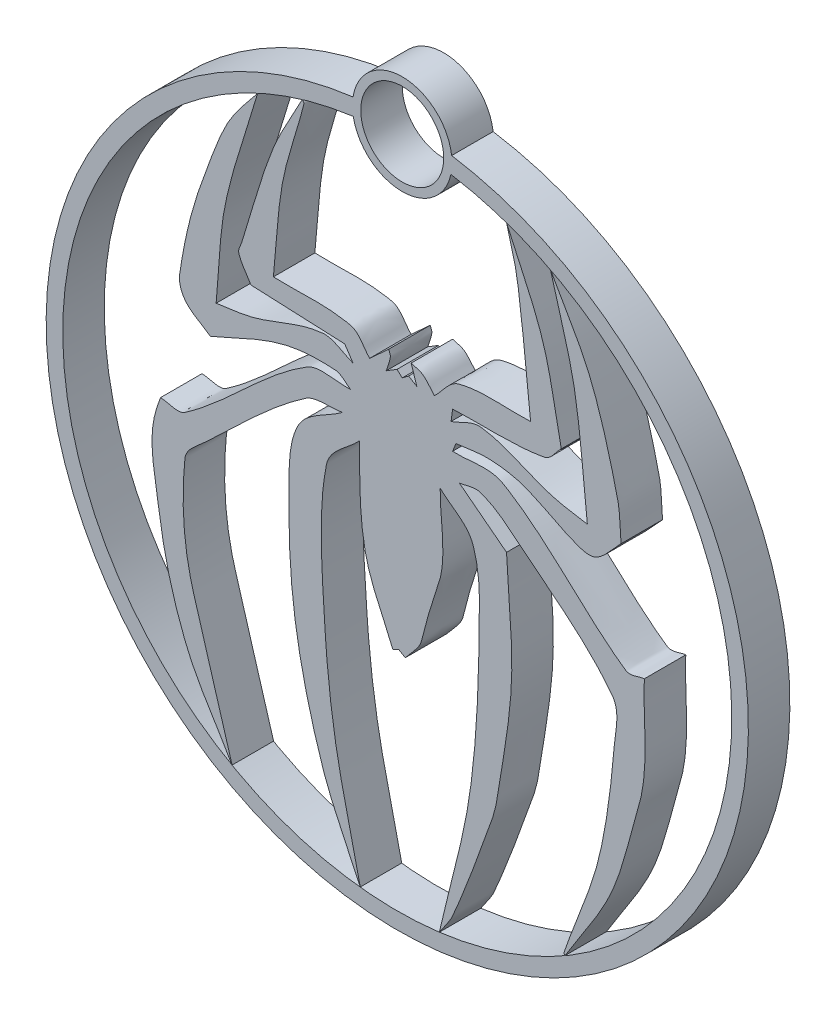
from build123d import *

# Parameters (mm, degrees)
BOSS_EXTRUDE1_DEPTH = 50
SKETCH1_4_R         = 50
BOSS_EXTRUDE2_DEPTH = 50


with BuildPart() as part:
    # Sketch1 → Boss-Extrude1 (new body)
    with BuildSketch(Plane.XY):
        with BuildLine():
            Line((853, 918), (830, 897))
            add(Edge.make_bspline(
                [(714, 924), (745, 922.666666667), (776.779172775, 927.034158061), (807, 920), (817.560023831, 917.542063419), (822.333333333, 904.666666667), (830, 897)],
                knots=[0, 0, 0, 0, 1, 1, 1, 2, 2, 2, 2], degree=3))
            add(Edge.make_bspline(
                [(748.807903572, 1126.549902984), (749.499965997, 1125.457958941), (751.187832385, 1124.53066676), (750.884090847, 1123.274070854), (743.160818122, 1091.32245522), (730.996535349, 1060.435291137), (725.013838745, 1028.112512411), (718.662403289, 993.797544357), (717.671279582, 958.704170804), (714, 924)],
                knots=[0, 0, 0, 0, 1, 1, 1, 2, 2, 2, 3, 3, 3, 3], degree=3))
            add(Edge.make_bspline(
                [(687, 902), (682.132270872, 910.611900498), (675.158519698, 918.3366178), (672.396812615, 927.835701495), (671.167351835, 932.064517402), (674.452537828, 936.407602746), (675.775289638, 940.608172402), (687.851726885, 978.958462653), (697.890697373, 1018.049572234), (712.589625278, 1055.47318266), (722.310799686, 1080.223385281), (736.735144141, 1102.857662876), (748.807903572, 1126.549902984)],
                knots=[0, 0, 0, 0, 1, 1, 1, 2, 2, 2, 3, 3, 3, 4, 4, 4, 4], degree=3))
            Line((687, 902), (800, 897))
            Line((800, 897), (810, 882))
            add(Edge.make_bspline(
                [(645, 862), (659.333333333, 864.333333333), (673.937806149, 865.374590648), (688, 869), (716.691021266, 876.39690392), (743.537603082, 891.860564263), (773, 895), (785.998858399, 896.385124256), (797.666666667, 886.333333333), (810, 882)],
                knots=[0, 0, 0, 0, 1, 1, 1, 2, 2, 2, 3, 3, 3, 3], degree=3))
            add(Edge.make_bspline(
                [(695, 1106), (682, 1061), (665.402999701, 1016.886638541), (656, 971), (648.669161244, 935.22550687), (648.666666667, 898.333333333), (645, 862)],
                knots=[0, 0, 0, 0, 1, 1, 1, 2, 2, 2, 2], degree=3))
            add(Edge.make_bspline(
                [(638, 824), (628, 831.333333333), (615.772256472, 836.337194656), (608, 846), (602.777011293, 852.493445419), (599.812741137, 861.751675271), (601, 870), (606.275492274, 906.650788428), (614.515152584, 943.139711761), (627, 978), (657.408327541, 1062.906369108), (658.716781846, 1061.179554045), (695, 1106)],
                knots=[0, 0, 0, 0, 1, 1, 1, 2, 2, 2, 3, 3, 3, 4, 4, 4, 4], degree=3))
            add(Edge.make_bspline(
                [(807, 853), (801, 856.666666667), (796.013373278, 863.493009161), (789, 864), (767.32588298, 865.56680364), (745.00614433, 864.564541544), (724, 859), (694.082127801, 851.074735841), (666.666666667, 835.666666667), (638, 824)],
                knots=[0, 0, 0, 0, 1, 1, 1, 2, 2, 2, 3, 3, 3, 3], degree=3))
            add(Edge.make_bspline(
                [(578, 730), (587.666666667, 729.666666667), (599.008388664, 723.551174089), (607, 729), (659.436333139, 764.752045322), (700.061116149, 816.557892012), (754, 850), (769.038982167, 859.324168944), (789.333333333, 852), (807, 853)],
                knots=[0, 0, 0, 0, 1, 1, 1, 2, 2, 2, 3, 3, 3, 3], degree=3))
            add(Edge.make_bspline(
                [(664.295395655, 389.339676843), (645.92602994, 421.882933624), (623.416536006, 452.414766476), (609.187298512, 486.969447186), (594.510435756, 522.611153675), (584.13086398, 560.291692971), (578.214769352, 598.380291871), (567.753529298, 665.731137564), (560.969349446, 686.564113594), (578, 730)],
                knots=[0, 0, 0, 0, 1, 1, 1, 2, 2, 2, 3, 3, 3, 3], degree=3))
            add(Edge.make_bspline(
                [(797, 824), (782.186255781, 821.509084593), (764.93630489, 825.038907063), (752.558767342, 816.52725378), (708.444039653, 786.190907371), (670.969694886, 747.116340911), (631.925686129, 710.48345278), (622.403465214, 701.549266342), (608.400074174, 693.12130585), (607.175121958, 680.121618526), (602.950264034, 635.285721002), (605.161082018, 588.631255238), (617.939003511, 545.447556305), (633.340704553, 493.396647926), (648.724230286, 441.340140948), (664.295395655, 389.339676843)],
                knots=[0, 0, 0, 0, 1, 1, 1, 2, 2, 2, 3, 3, 3, 4, 4, 4, 5, 5, 5, 5], degree=3))
            add(Edge.make_bspline(
                [(818.747711161, 339.269839649), (803.617628269, 373.444822067), (785.13080843, 406.323148135), (773.357462485, 441.794786902), (759.1165288, 484.700963085), (747.9358369, 528.82940624), (741.003827866, 573.50256818), (734.35988778, 616.319276852), (732.224304235, 659.904731985), (732.790100312, 703.230155886), (733.143603872, 730.299434411), (731.040234071, 759.798987998), (743.748869708, 783.702154835), (754.198763531, 803.356944114), (779.249623236, 810.567384945), (797, 824)],
                knots=[0, 0, 0, 0, 1, 1, 1, 2, 2, 2, 3, 3, 3, 4, 4, 4, 5, 5, 5, 5], degree=3))
            add(Edge.make_bspline(
                [(818, 805), (804.612268242, 789.890017522), (781.692895636, 779.486043457), (777.836804726, 759.670052565), (767.012241716, 704.043915357), (772.709880371, 646.238468315), (776.097934025, 589.6702847), (779.355372721, 535.28289624), (786.277501979, 480.855515055), (798.4876641, 427.756448478), (805.268718476, 398.267269365), (811.994362141, 368.765375926), (818.747711161, 339.269839649)],
                knots=[0, 0, 0, 0, 1, 1, 1, 2, 2, 2, 3, 3, 3, 4, 4, 4, 4], degree=3))
            add(Edge.make_bspline(
                [(858, 607), (847.333333333, 633.666666667), (832.615076179, 659.051303143), (826, 687), (816.91983626, 725.363691802), (818, 765.576374821), (818, 805)],
                knots=[0, 0, 0, 0, 1, 1, 1, 2, 2, 2, 2], degree=3))
            Line((858, 607), (864.822790605, 610.672691083))
            Line((864.822790605, 610.672691083), (873, 606))
            add(Edge.make_bspline(
                [(915, 804), (914.652871367, 770.328522596), (923.865485221, 734.872089982), (913, 703), (882.795455375, 614.400002434), (903.009742143, 641.466058896), (873, 606)],
                knots=[0, 0, 0, 0, 1, 1, 1, 2, 2, 2, 2], degree=3))
            add(Edge.make_bspline(
                [(914, 340), (926.333333333, 395), (943.074894972, 449.194052096), (951, 505), (959.124372139, 562.209120481), (961.335870084, 620.220697301), (962, 678), (962.338532765, 707.452350519), (964.294073125, 738.403123111), (954, 766), (947.656489026, 783.006008143), (928, 791.333333333), (915, 804)],
                knots=[0, 0, 0, 0, 1, 1, 1, 2, 2, 2, 3, 3, 3, 4, 4, 4, 4], degree=3))
            add(Edge.make_bspline(
                [(995, 777), (997, 733), (1002.854674398, 689.006365254), (1001, 645), (999.173691938, 601.666690526), (990.553946299, 558.87373204), (984, 516), (982.546225991, 506.489895022), (980.22418735, 497.064224814), (977, 488), (962.539080656, 447.345717315), (947.900285267, 406.702257452), (931, 367), (926.834474576, 357.214321227), (919.666666667, 349), (914, 340)],
                knots=[0, 0, 0, 0, 1, 1, 1, 2, 2, 2, 3, 3, 3, 4, 4, 4, 5, 5, 5, 5], degree=3))
            Line((995, 777), (938, 821))
            add(Edge.make_bspline(
                [(1065.327844531, 391.067062344), (1065.005518346, 392.121075528), (1064.010520862, 393.1840678), (1064.360865976, 394.229101897), (1077.639361774, 433.837134947), (1096.045026806, 471.860652645), (1106.013910006, 512.428325741), (1116.320249891, 554.369255218), (1121.073299242, 597.591406157), (1124.905133667, 640.609765635), (1126.425451157, 657.677717187), (1132.392914512, 678.307853328), (1122.003303839, 691.934383537), (1090.23345357, 733.602241755), (1045.643017831, 763.798722321), (1005.396813721, 797.35132057), (992.908604923, 807.762534793), (979.552834348, 818.09994214), (964.211074201, 823.483169441), (955.929929524, 826.388917131), (946.737024734, 821.827723147), (938, 821)],
                knots=[0, 0, 0, 0, 1, 1, 1, 2, 2, 2, 3, 3, 3, 4, 4, 4, 5, 5, 5, 6, 6, 6, 7, 7, 7, 7], degree=3))
            add(Edge.make_bspline(
                [(1161, 728), (1159.307914298, 682.385414571), (1167.399797701, 634.913303629), (1154.146552367, 591.233731218), (1143.421231256, 555.885601136), (1136.496641272, 519.093539542), (1121.514433045, 485.32882053), (1106.678416673, 451.89356743), (1084.056707369, 422.487648406), (1065.327844531, 391.067062344)],
                knots=[0, 0, 0, 0, 1, 1, 1, 2, 2, 2, 3, 3, 3, 3], degree=3))
            add(Edge.make_bspline(
                [(930, 850), (950.666666667, 848.666666667), (974.211523607, 856.604668619), (992, 846), (1046.109871998, 813.742191693), (1086.348962946, 762.064037706), (1138, 726), (1144.309736791, 721.594384963), (1153.333333333, 727.333333333), (1161, 728)],
                knots=[0, 0, 0, 0, 1, 1, 1, 2, 2, 2, 3, 3, 3, 3], degree=3))
            Line((930, 850), (934, 860))
            add(Edge.make_bspline(
                [(1133, 855), (1123, 845.333333333), (1115.245971274, 832.593984532), (1103, 826), (1096.53654514, 822.519678152), (1087.92385396, 824.560915082), (1081, 827), (1058.206831137, 835.029411759), (1037.861671571, 849.167760666), (1015, 857), (1001.572993314, 861.599993031), (987.183387929, 863.474689336), (973, 864), (959.940756698, 864.483675678), (947, 861.333333333), (934, 860)],
                knots=[0, 0, 0, 0, 1, 1, 1, 2, 2, 2, 3, 3, 3, 4, 4, 4, 5, 5, 5, 5], degree=3))
            add(Edge.make_bspline(
                [(1047.980289815, 1098.366972954), (1063.83372929, 1069.03385432), (1082.929941258, 1041.234014156), (1095.54060824, 1010.36761705), (1109.908050781, 975.201262451), (1119.599822646, 938.204438287), (1128.503682102, 901.274542705), (1132.136069044, 886.208753412), (1131.501227367, 870.424847568), (1133, 855)],
                knots=[0, 0, 0, 0, 1, 1, 1, 2, 2, 2, 3, 3, 3, 3], degree=3))
            add(Edge.make_bspline(
                [(1092.400561035, 855), (1087.115481848, 900.034510513), (1084.687094884, 945.496909189), (1076.545323472, 990.103531539), (1069.843737043, 1026.819759481), (1057.501967701, 1062.279159149), (1047.980289815, 1098.366972954)],
                knots=[0, 0, 0, 0, 1, 1, 1, 2, 2, 2, 2], degree=3))
            add(Edge.make_bspline(
                [(1092.400561035, 855), (1078.147239942, 857.780598264), (1063.582490503, 859.278235328), (1049.640597756, 863.341794792), (1021.195026211, 871.632654118), (994.845353429, 887.92861959), (965.495592263, 891.988226517), (952.546428944, 893.779331829), (940.569869376, 884.097479143), (928.107007933, 880.152105456)],
                knots=[0, 0, 0, 0, 1, 1, 1, 2, 2, 2, 3, 3, 3, 3], degree=3))
            Line((928.107007933, 880.152105456), (930, 894))
            add(Edge.make_bspline(
                [(1061, 918), (1054, 911.666666667), (1049.285325701, 900.701128373), (1040, 899), (1003.896373176, 892.385595086), (966.666666667, 895.666666667), (930, 894)],
                knots=[0, 0, 0, 0, 1, 1, 1, 2, 2, 2, 2], degree=3))
            add(Edge.make_bspline(
                [(995, 1121.034294216), (1009.338783547, 1087.823670693), (1026.833399348, 1055.804281573), (1038.016350641, 1021.402423647), (1048.931836193, 987.82336448), (1053.338783547, 952.467474549), (1061, 918)],
                knots=[0, 0, 0, 0, 1, 1, 1, 2, 2, 2, 2], degree=3))
            add(Edge.make_bspline(
                [(1024, 928), (1018.667310318, 974.643715948), (1014.976704628, 1021.504578417), (1008.001930954, 1067.931147845), (1005.294494045, 1085.952808983), (999.333976985, 1103.333245426), (995, 1121.034294216)],
                knots=[0, 0, 0, 0, 1, 1, 1, 2, 2, 2, 2], degree=3))
            add(Edge.make_bspline(
                [(908, 897), (918, 906), (925.00249996, 920.526530162), (938, 924), (965.724708626, 931.409189374), (995.333333333, 926.666666667), (1024, 928)],
                knots=[0, 0, 0, 0, 1, 1, 1, 2, 2, 2, 2], degree=3))
            add(Edge.make_bspline(
                [(880, 917), (884.666666667, 915.333333333), (889.967660758, 914.880242315), (894, 912), (899.565471631, 908.024663121), (903.333333333, 902), (908, 897)],
                knots=[0, 0, 0, 0, 1, 1, 1, 2, 2, 2, 2], degree=3))
            Line((880, 917), (887, 896))
            Line((887, 896), (877, 902))
            Line((877, 902), (869.290410884, 896.217808163))
            Line((869.290410884, 896.217808163), (863, 902))
            Line((863, 902), (850, 894))
            add(Edge.make_bspline(
                [(853, 918), (853.666666667, 915.666666667), (855.300995499, 913.407963994), (855, 911), (854.267366301, 905.138930409), (851.666666667, 899.666666667), (850, 894)],
                knots=[0, 0, 0, 0, 1, 1, 1, 2, 2, 2, 2], degree=3))
        make_face()
    extrude(amount=BOSS_EXTRUDE1_DEPTH)


with BuildPart() as body_2:
    # Sketch1<4> → Boss-Extrude2 (new body)
    with BuildSketch(Plane.XY):
        with BuildLine():
            ThreePointArc((809.996303835, 1159.77841479), (857.137413146, 316.845071097), (928.826788534, 1158.046319047))
            ThreePointArc((928.826788534, 1158.046319047), (870.164889401, 1210.595502779), (809.996303835, 1159.77841479))
        make_face()
        with BuildLine():
            ThreePointArc((810.298422275, 1139.649922478), (868.415932368, 1090.608248668), (927.93812963, 1137.935183733))
            ThreePointArc((927.93812963, 1137.935183733), (857.428905985, 336.842946782), (810.298422275, 1139.649922478))
        make_face(mode=Mode.SUBTRACT)
        with Locations((869.290410884, 1150.601875723)):
            Circle(SKETCH1_4_R, mode=Mode.SUBTRACT)
    extrude(amount=BOSS_EXTRUDE2_DEPTH)


solid = Compound([part.part, body_2.part])
